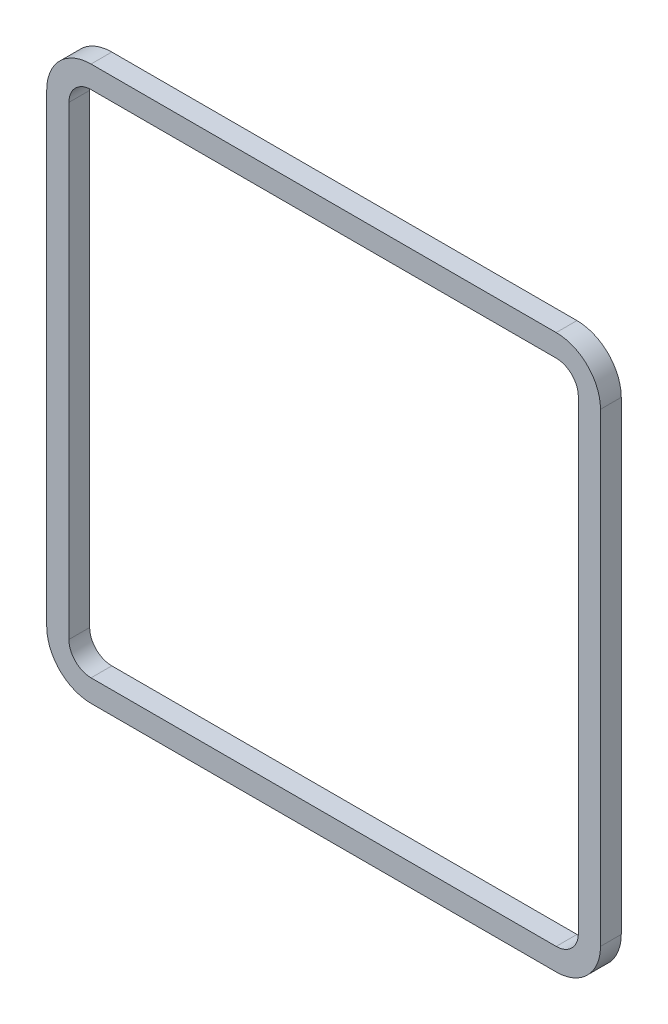
from build123d import *

# Parameters (mm, degrees)
BOSS_EXTRUDE1_DEPTH = 4.7625


with BuildPart() as part:
    # Sketch1 → Boss-Extrude1 (new body)
    with BuildSketch(Plane.XY):
        with BuildLine():
            Line((53.34, 63.5), (-53.34, 63.5))
            ThreePointArc((-53.34, 63.5), (-60.524204897, 60.524204897), (-63.5, 53.34))
            Line((-63.5, 53.34), (-63.5, -53.34))
            ThreePointArc((-63.5, -53.34), (-60.524204897, -60.524204897), (-53.34, -63.5))
            Line((-53.34, -63.5), (53.34, -63.5))
            ThreePointArc((53.34, -63.5), (60.524204897, -60.524204897), (63.5, -53.34))
            Line((63.5, -53.34), (63.5, 53.34))
            ThreePointArc((63.5, 53.34), (60.524204897, 60.524204897), (53.34, 63.5))
        make_face()
        with BuildLine():
            Line((53.34, 58.42), (-53.34, 58.42))
            ThreePointArc((-53.34, 58.42), (-56.932102448, 56.932102448), (-58.42, 53.34))
            Line((-58.42, 53.34), (-58.42, -53.34))
            ThreePointArc((-58.42, -53.34), (-56.932102448, -56.932102448), (-53.34, -58.42))
            Line((-53.34, -58.42), (53.34, -58.42))
            ThreePointArc((53.34, -58.42), (56.932102448, -56.932102448), (58.42, -53.34))
            Line((58.42, -53.34), (58.42, 53.34))
            ThreePointArc((58.42, 53.34), (56.932102448, 56.932102448), (53.34, 58.42))
        make_face(mode=Mode.SUBTRACT)
    extrude(amount=BOSS_EXTRUDE1_DEPTH)


solid = part.part
